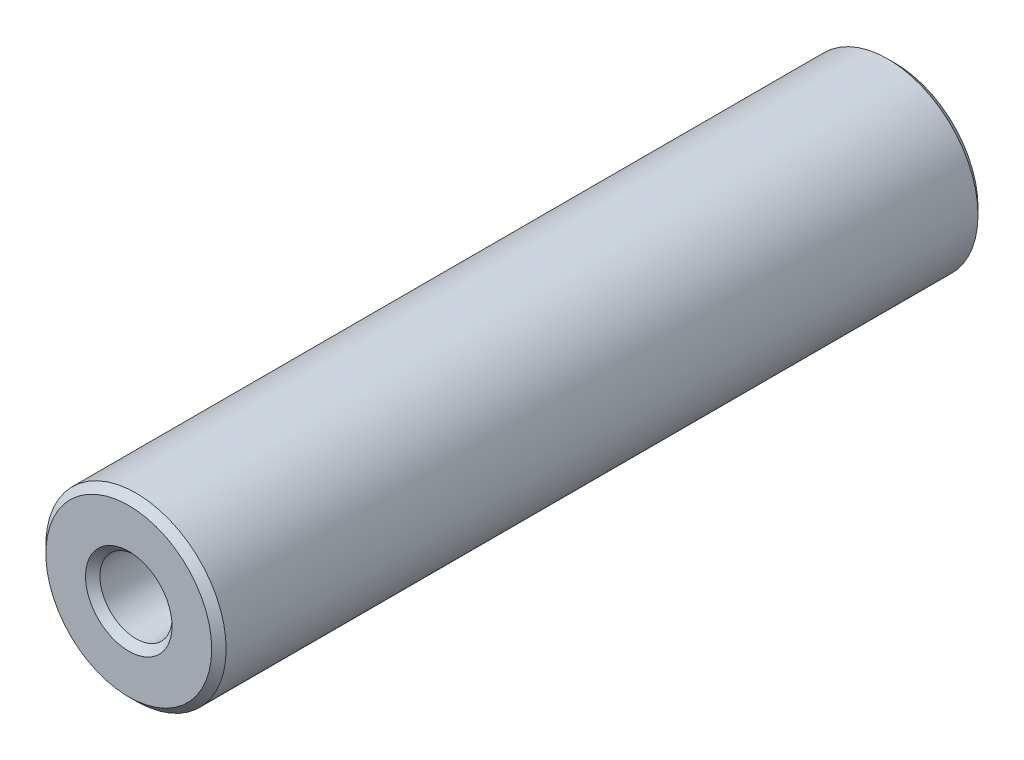
from build123d import *

# Parameters (mm, degrees)
SKETCH1_R           = 6.35
SKETCH1_R_2         = 2.54
BOSS_EXTRUDE1_DEPTH = 53.975
CHAMFER1_SIZE       = 0.508


with BuildPart() as part:
    # Sketch1 → Boss-Extrude1 (new body)
    with BuildSketch(Plane.XY):
        Circle(SKETCH1_R)
        Circle(SKETCH1_R_2, mode=Mode.SUBTRACT)
    extrude(amount=BOSS_EXTRUDE1_DEPTH)

    # Chamfer1
    chamfer1_edges = [part.edges().sort_by_distance(p)[0] for p in [
        (-2.54, 0, 0),
        (-6.35, 0, 0),
        (-2.54, 0, 53.975),
        (-6.35, 0, 53.975),
    ]]
    chamfer(chamfer1_edges, length=CHAMFER1_SIZE)


solid = part.part
